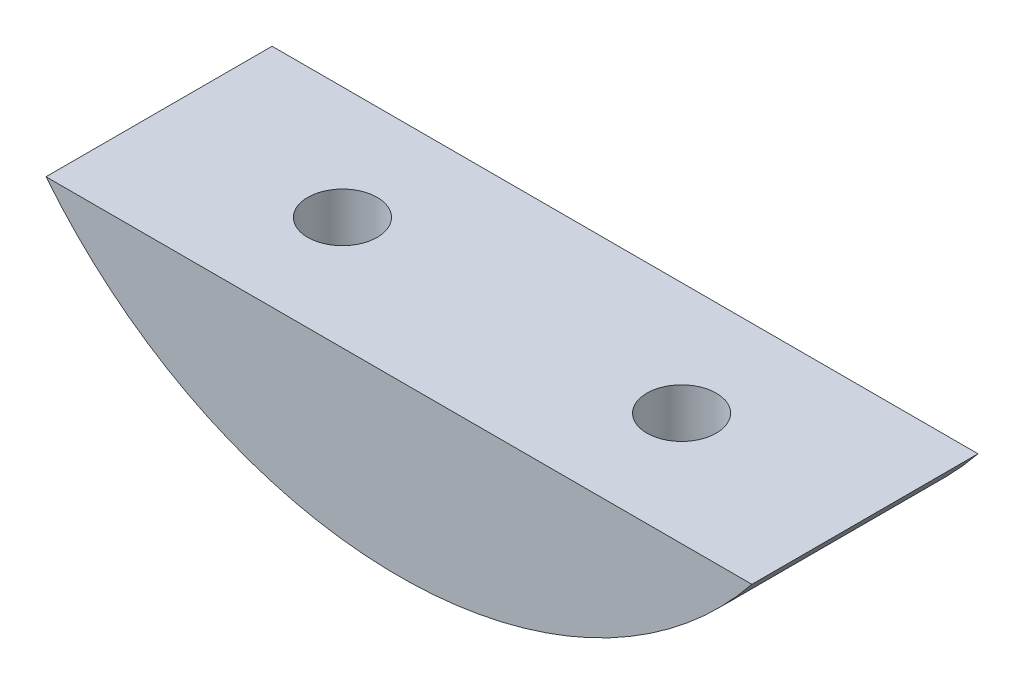
from build123d import *

# Parameters (mm, degrees)
BOSS_EXTRUDE1_DEPTH     = 25.4
CUT_EXTRUDE1_DEPTH      = 86.430512699
CUT_EXTRUDE1_DEPTH_BACK = 86.430512699
SKETCH2_R               = 2.5
SKETCH3_R               = 3.9
CUT_EXTRUDE2_DEPTH      = 6.8


with BuildPart() as part:
    # Sketch1 → Boss-Extrude1 (new body)
    with BuildSketch(Plane.XY):
        with BuildLine():
            Line((0, 0), (79.31147458, 0))
            ThreePointArc((79.31147458, 0), (39.65573729, -19.05), (0, 0))
        make_face()
    extrude(amount=BOSS_EXTRUDE1_DEPTH)

    # Sketch2 → Cut-Extrude1 (cut, two sides: drawn at the far end of the back side and taken through both)
    with BuildSketch(Plane(origin=(0, 0, 0), x_dir=(1, 0, 0), z_dir=(0, 1, 0)).offset(-CUT_EXTRUDE1_DEPTH_BACK)):
        with Locations((20.60573729, -12.7)):
            Circle(SKETCH2_R)
        with Locations((58.70573729, -12.7)):
            Circle(SKETCH2_R)
    extrude(amount=CUT_EXTRUDE1_DEPTH + CUT_EXTRUDE1_DEPTH_BACK, mode=Mode.SUBTRACT)

    # Sketch3 → Cut-Extrude2 (cut)
    with BuildSketch(Plane(origin=(0, 0, 0), x_dir=(1, 0, 0), z_dir=(0, 1, 0))):
        with Locations((20.60573729, -12.7)):
            Circle(SKETCH3_R)
        with Locations((58.70573729, -12.7)):
            Circle(SKETCH3_R)
    extrude(amount=-CUT_EXTRUDE2_DEPTH, mode=Mode.SUBTRACT)


solid = part.part
